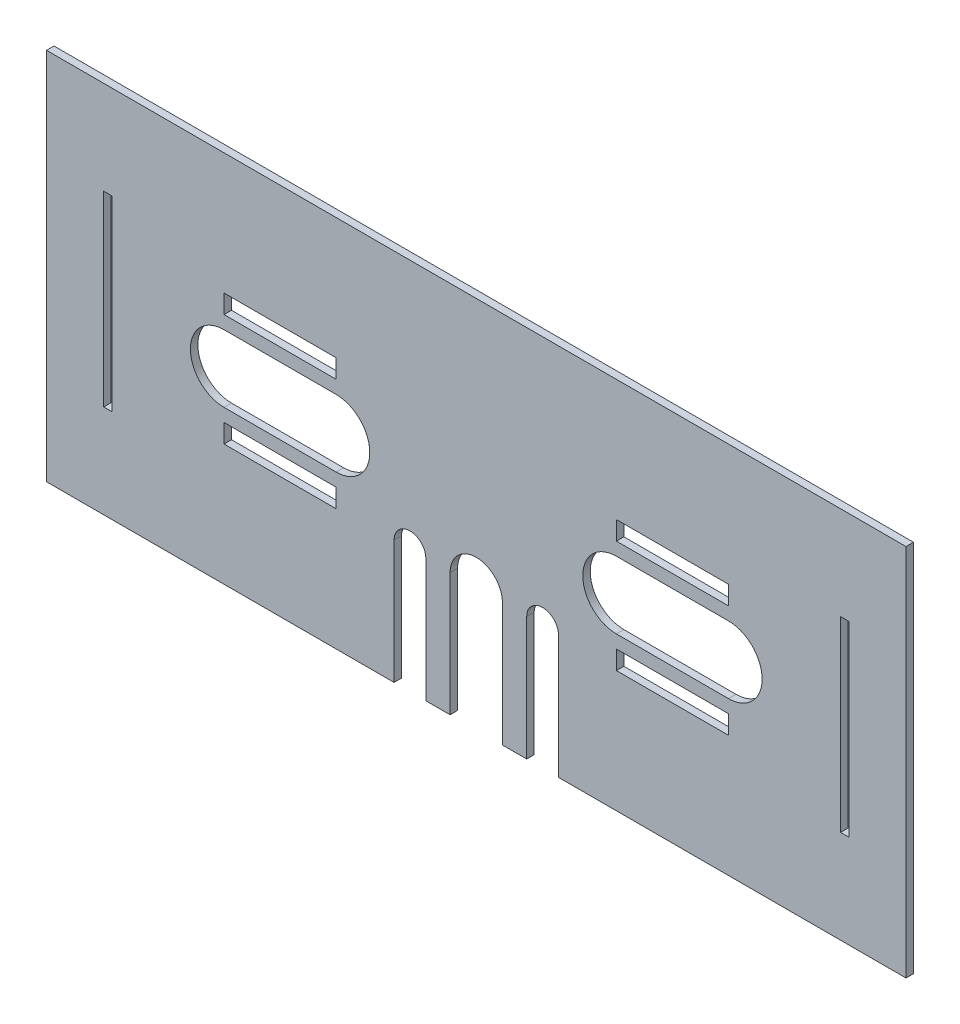
from build123d import *

# Parameters (mm, degrees)
SKETCH_1_W               = 230
SKETCH_1_H               = 100
EXTRUDE_1_DEPTH          = 2
CUT_EXTRUDE_2_DEPTH      = 2
CUT_EXTRUDE_2_DEPTH_BACK = 2
SKETCH_3_W               = 2.2
SKETCH_3_H               = 50
SKETCH_3_W_2             = 30
SKETCH_3_H_2             = 5
CUT_EXTRUDE_3_DEPTH      = 2
CUT_EXTRUDE_3_DEPTH_BACK = 2


with BuildPart() as part:
    # 草图1 → 凸台-拉伸1 (new body)
    with BuildSketch(Plane.XY):
        with Locations((65.955242642, -29.076013845)):
            Rectangle(SKETCH_1_W, SKETCH_1_H)
    extrude(amount=EXTRUDE_1_DEPTH)

    # 草图3 → 切除-拉伸2 (cut, two sides: drawn at the far end of the back side and taken through both)
    with BuildSketch(Plane.XY.offset(-CUT_EXTRUDE_2_DEPTH_BACK)):
        with Locations((-32.644757358, -29.076013845)):
            Rectangle(SKETCH_3_W, SKETCH_3_H)
        with Locations((13.455242642, -14.076013845)):
            Rectangle(SKETCH_3_W_2, SKETCH_3_H_2)
        with BuildLine():
            Line((-1.544757358, -20.076013845), (28.455242642, -20.076013845))
            ThreePointArc((28.455242642, -20.076013845), (37.455242642, -29.076013845), (28.455242642, -38.076013845))
            Line((28.455242642, -38.076013845), (-1.544757358, -38.076013845))
            ThreePointArc((-1.544757358, -38.076013845), (-10.544757358, -29.076013845), (-1.544757358, -20.076013845))
        make_face()
        with Locations((13.455242642, -44.076013845)):
            Rectangle(SKETCH_3_W_2, SKETCH_3_H_2)
        with Locations((118.455242642, -44.076013845)):
            Rectangle(SKETCH_3_W_2, SKETCH_3_H_2)
        with BuildLine():
            Line((133.455242642, -38.076013845), (103.455242642, -38.076013845))
            ThreePointArc((103.455242642, -38.076013845), (94.455242642, -29.076013845), (103.455242642, -20.076013845))
            Line((103.455242642, -20.076013845), (133.455242642, -20.076013845))
            ThreePointArc((133.455242642, -20.076013845), (142.455242642, -29.076013845), (133.455242642, -38.076013845))
        make_face()
        with Locations((118.455242642, -14.076013845)):
            Rectangle(SKETCH_3_W_2, SKETCH_3_H_2)
        with Locations((164.555242642, -29.076013845)):
            Rectangle(SKETCH_3_W, SKETCH_3_H)
    extrude(amount=CUT_EXTRUDE_2_DEPTH + CUT_EXTRUDE_2_DEPTH_BACK, mode=Mode.SUBTRACT)

    # 草图4 → 切除-拉伸3 (cut, two sides: drawn at the far end of the back side and taken through both)
    with BuildSketch(Plane.XY.offset(-CUT_EXTRUDE_3_DEPTH_BACK)):
        with BuildLine():
            Line((43.955242642, -46.076013845), (43.955242642, -79.076013845))
            Line((43.955242642, -79.076013845), (52.455242642, -79.076013845))
            Line((52.455242642, -79.076013845), (52.455242642, -46.076013845))
            ThreePointArc((52.455242642, -46.076013845), (48.205242642, -41.826013845), (43.955242642, -46.076013845))
        make_face()
        with BuildLine():
            Line((58.955242642, -46.076013845), (58.955242642, -79.076013845))
            Line((58.955242642, -79.076013845), (72.955242642, -79.076013845))
            Line((72.955242642, -79.076013845), (72.955242642, -46.076013845))
            ThreePointArc((72.955242642, -46.076013845), (65.955242642, -39.076013845), (58.955242642, -46.076013845))
        make_face()
        with BuildLine():
            Line((79.455242642, -46.076013845), (79.455242642, -79.076013845))
            Line((79.455242642, -79.076013845), (87.955242642, -79.076013845))
            Line((87.955242642, -79.076013845), (87.955242642, -46.076013845))
            ThreePointArc((87.955242642, -46.076013845), (83.705242642, -41.826013845), (79.455242642, -46.076013845))
        make_face()
    extrude(amount=CUT_EXTRUDE_3_DEPTH + CUT_EXTRUDE_3_DEPTH_BACK, mode=Mode.SUBTRACT)


solid = part.part
